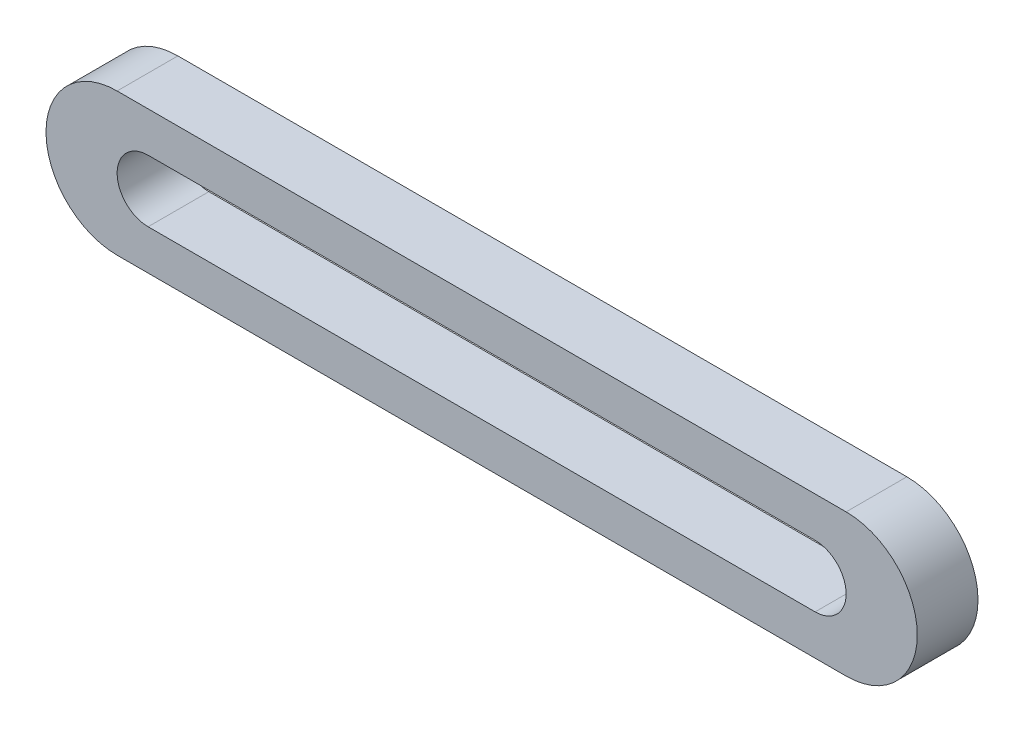
from build123d import *

# Parameters (mm, degrees)
BOSS_EXTRUDE2_DEPTH = 12.7
CUT_EXTRUDE1_DEPTH  = 38.862


with BuildPart() as part:
    # Sketch1 → Boss-Extrude2 (new body)
    with BuildSketch(Plane.XY):
        with BuildLine():
            Line((-82.55, -14.868259737), (-234.95, -14.868259737))
            ThreePointArc((-234.95, -14.868259737), (-249.818259737, 0), (-234.95, 14.868259737))
            Line((-234.95, 14.868259737), (-82.55, 14.868259737))
            ThreePointArc((-82.55, 14.868259737), (-67.681740263, 0), (-82.55, -14.868259737))
        make_face()
    extrude(amount=BOSS_EXTRUDE2_DEPTH)

    # Sketch2 → Cut-Extrude1 (cut)
    with BuildSketch(Plane(origin=(0, 0, 0), x_dir=(-1, 0, 0), z_dir=(0, 0, -1))):
        with BuildLine():
            Line((228.473, -6.477), (89.027, -6.477))
            ThreePointArc((89.027, -6.477), (82.55, 0), (89.027, 6.477))
            Line((89.027, 6.477), (228.473, 6.477))
            ThreePointArc((228.473, 6.477), (234.95, 0), (228.473, -6.477))
        make_face()
    extrude(amount=-CUT_EXTRUDE1_DEPTH, mode=Mode.SUBTRACT)


solid = part.part
